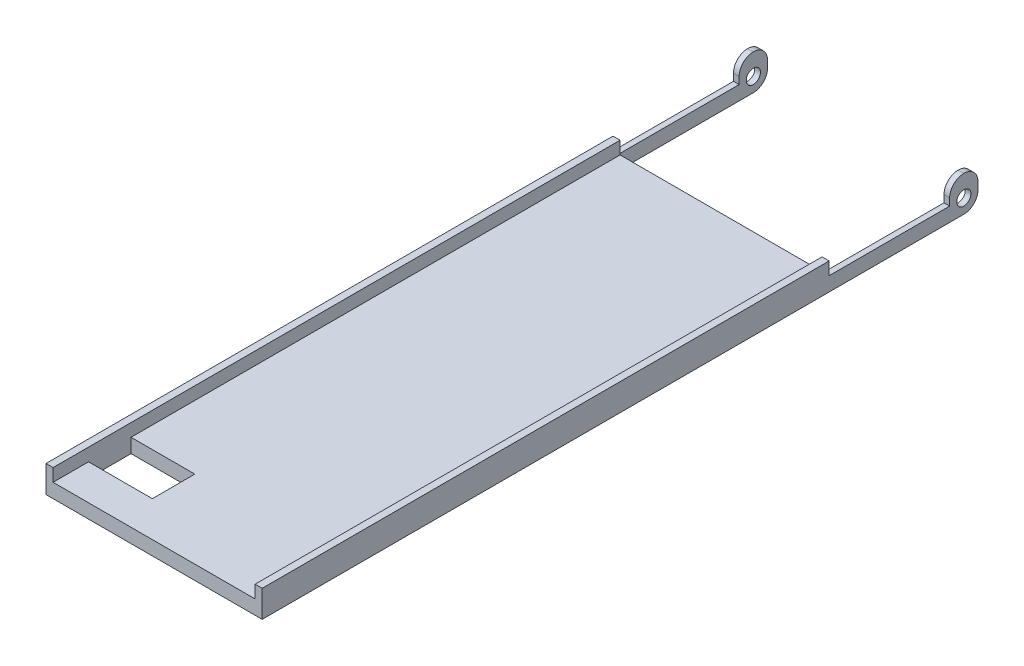
from build123d import *

# Parameters (mm, degrees)
SKETCH1_W           = 30.5
SKETCH1_H           = 85
BOSS_EXTRUDE1_DEPTH = 2
CUT_EXTRUDE1_DEPTH  = 2
SKETCH5_W           = 0.8
SKETCH5_H           = 4
BOSS_EXTRUDE2_DEPTH = 3
SKETCH6_R           = 1
CUT_EXTRUDE2_DEPTH  = 0.8
FILLET1_R           = 2
FILLET2_R           = 2
SKETCH7_W           = 30.5
SKETCH7_H           = 2
BOSS_EXTRUDE3_DEPTH = 16
SKETCH8_W           = 30.5
SKETCH8_H           = 80
BOSS_EXTRUDE4_DEPTH = 1.8
SKETCH9_W           = 28.5
SKETCH9_H           = 80
CUT_EXTRUDE3_DEPTH  = 1.8
SKETCH10_W          = 28.9
SKETCH10_H          = 2
CUT_EXTRUDE4_DEPTH  = 1
SKETCH11_W          = 9
SKETCH11_H          = 6
CUT_EXTRUDE5_DEPTH  = 2


with BuildPart() as part:
    # Sketch1 → Boss-Extrude1 (new body)
    with BuildSketch(Plane(origin=(0, 0, 0), x_dir=(1, 0, 0), z_dir=(0, 1, 0))):
        Rectangle(SKETCH1_W, SKETCH1_H)
    extrude(amount=BOSS_EXTRUDE1_DEPTH)

    # Sketch2 → Cut-Extrude1 (cut)
    with BuildSketch(Plane(origin=(0, 2, 0), x_dir=(1, 0, 0), z_dir=(0, 1, 0))):
        Polygon((14.45, 42.5), (-14.45, 42.5), (-14.45, 24.5), (-14.45, 22.5), (14.45, 22.5), (14.45, 24.5), align=None)
    extrude(amount=-CUT_EXTRUDE1_DEPTH, mode=Mode.SUBTRACT)

    # Sketch5 → Boss-Extrude2 (add)
    with BuildSketch(Plane(origin=(0, 2, 0), x_dir=(1, 0, 0), z_dir=(0, 1, 0))):
        with Locations((-14.85, 40.5)):
            Rectangle(SKETCH5_W, SKETCH5_H)
    boss_extrude2 = extrude(amount=BOSS_EXTRUDE2_DEPTH)

    # Sketch6 → Cut-Extrude2 (cut)
    with BuildSketch(Plane.ZY.offset(15.25)):
        with Locations((-40.5, 2)):
            Circle(SKETCH6_R)
    cut_extrude2 = extrude(amount=-CUT_EXTRUDE2_DEPTH, mode=Mode.SUBTRACT)

    # Mirror1: Boss-Extrude2, Cut-Extrude2 across plane
    add(boss_extrude2.mirror(Plane(origin=(0, 0, 0), x_dir=(0, 0, 1), z_dir=(1, 0, 0))))
    add(cut_extrude2.mirror(Plane(origin=(0, 0, 0), x_dir=(0, 0, 1), z_dir=(1, 0, 0))), mode=Mode.SUBTRACT)

    # Fillet1
    fillet1_edges = [part.edges().sort_by_distance(p)[0] for p in [
        (-14.85, 0, -42.5),
        (-14.85, 5, -42.5),
        (-14.85, 5, -38.5),
    ]]
    fillet(fillet1_edges, radius=FILLET1_R - 0.0001)  # a hair under: the kernel refuses the full size

    # Fillet2
    fillet2_edges = [part.edges().sort_by_distance(p)[0] for p in [
        (14.85, 0, -42.5),
        (14.85, 5, -38.5),
        (14.85, 5, -42.5),
    ]]
    fillet(fillet2_edges, radius=FILLET2_R - 0.0001)  # a hair under: the kernel refuses the full size

    # Sketch7 → Boss-Extrude3 (add)
    with BuildSketch(Plane.XY.offset(42.5)):
        with Locations((0, 1)):
            Rectangle(SKETCH7_W, SKETCH7_H)
    extrude(amount=BOSS_EXTRUDE3_DEPTH)

    # Sketch8 → Boss-Extrude4 (add)
    with BuildSketch(Plane(origin=(0, 2, 0), x_dir=(1, 0, 0), z_dir=(0, 1, 0))):
        with Locations((0, -18.5)):
            Rectangle(SKETCH8_W, SKETCH8_H)
    extrude(amount=BOSS_EXTRUDE4_DEPTH)

    # Sketch9 → Cut-Extrude3 (cut)
    with BuildSketch(Plane(origin=(0, 3.8, 0), x_dir=(1, 0, 0), z_dir=(0, 1, 0))):
        with Locations((0, -18.5)):
            Rectangle(SKETCH9_W, SKETCH9_H)
    extrude(amount=-CUT_EXTRUDE3_DEPTH, mode=Mode.SUBTRACT)

    # Sketch10 → Cut-Extrude4 (cut)
    with BuildSketch(Plane(origin=(0, 0, -22.5), x_dir=(-1, 0, 0), z_dir=(0, 0, -1))):
        with Locations((0, 1)):
            Rectangle(SKETCH10_W, SKETCH10_H)
    extrude(amount=-CUT_EXTRUDE4_DEPTH, mode=Mode.SUBTRACT)

    # Sketch11 → Cut-Extrude5 (cut)
    with BuildSketch(Plane(origin=(0, 2, 0), x_dir=(1, 0, 0), z_dir=(0, 1, 0))):
        with Locations((-9.75, -50.5)):
            Rectangle(SKETCH11_W, SKETCH11_H)
    extrude(amount=-CUT_EXTRUDE5_DEPTH, mode=Mode.SUBTRACT)


solid = part.part
